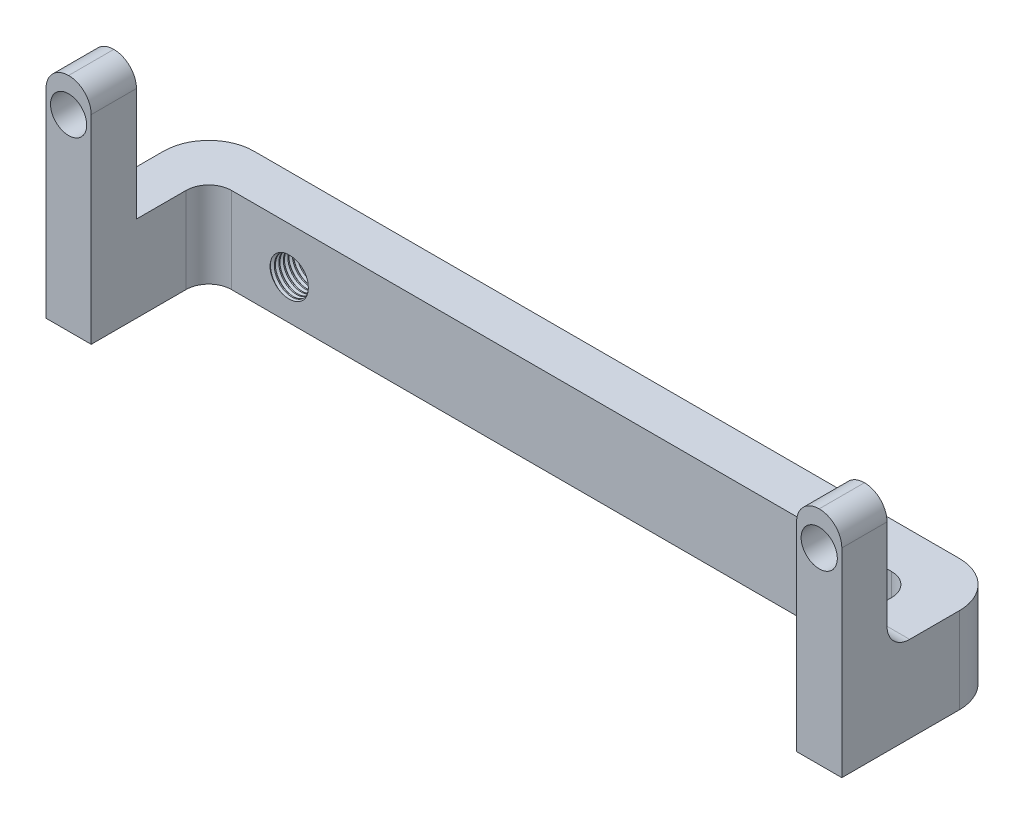
from build123d import *

# Parameters (mm, degrees)
BOSS_EXTRUDE1_DEPTH = 25
SKETCH2_W           = 10
SKETCH2_H           = 30
BOSS_EXTRUDE2_DEPTH = 10
FILLET1_R           = 5
SKETCH4_R           = 4
CUT_EXTRUDE2_DEPTH  = 10
FILLET2_R           = 10
CUT_EXTRUDE3_REACH  = 111.841
SKETCH3_R           = 4
THREAD1_PITCH       = 1
THREAD2_PITCH       = 1
FILLET3_R           = 5
CUT_EXTRUDE4_REACH  = 111.841
SKETCH5_W           = 176
SKETCH5_H           = 6


with BuildPart() as part:
    # Sketch1 → Boss-Extrude1 (new body)
    with BuildSketch(Plane(origin=(0, 0, 0), x_dir=(1, 0, 0), z_dir=(0, 1, 0))):
        Polygon((78, -10), (-78, -10), (-78, -36), (-88, -36), (-88, -10), (-88, 0), (88, 0), (88, -18), (88, -36), (78, -36), align=None)
    extrude(amount=BOSS_EXTRUDE1_DEPTH)

    # Sketch2 → Boss-Extrude2 (add)
    with BuildSketch(Plane.XY.offset(36)):
        with Locations((83, 40)):
            Rectangle(SKETCH2_W, SKETCH2_H)
        with Locations((-83, 40)):
            Rectangle(SKETCH2_W, SKETCH2_H)
    extrude(amount=-BOSS_EXTRUDE2_DEPTH)

    # Fillet1
    fillet1_edges = [part.edges().sort_by_distance(p)[0] for p in [
        (-88, 55, 31),
        (-78, 55, 31),
        (78, 55, 31),
        (88, 55, 31),
        (83, 25, 26),
    ]]
    fillet(fillet1_edges, radius=FILLET1_R - 0.0001)  # a hair under: the kernel refuses the full size

    # Sketch4 → Cut-Extrude2 (cut)
    with BuildSketch(Plane(origin=(0, 0, 26), x_dir=(-1, 0, 0), z_dir=(0, 0, -1))):
        with Locations((-83, 47.5)):
            Circle(SKETCH4_R)
        with Locations(Location((83, 47.5, 0), (0, 0, 180))):
            Circle(SKETCH4_R)
    extrude(amount=-CUT_EXTRUDE2_DEPTH, mode=Mode.SUBTRACT)

    # Fillet2
    fillet2_edges = [part.edges().sort_by_distance(p)[0] for p in [
        (-88, 12.5, 0),
        (88, 12.5, 0),
    ]]
    fillet(fillet2_edges, radius=FILLET2_R)

    # Sketch3 → Cut-Extrude3 (cut, up to next)
    with BuildSketch(Plane(origin=(0, 0, 0), x_dir=(-1, 0, 0), z_dir=(0, 0, -1)), mode=Mode.PRIVATE) as cut_extrude3_sk1:
        with Locations((-60, 15)):
            Circle(SKETCH3_R)
    cut_extrude3_tool1 = extrude(cut_extrude3_sk1.sketch, amount=-CUT_EXTRUDE3_REACH, mode=Mode.PRIVATE) & part.part
    # Sketch3 → Cut-Extrude3 (cut, up to next)
    with BuildSketch(Plane(origin=(0, 0, 0), x_dir=(-1, 0, 0), z_dir=(0, 0, -1)), mode=Mode.PRIVATE) as cut_extrude3_sk2:
        with Locations((60, 15)):
            Circle(SKETCH3_R)
    cut_extrude3_tool2 = extrude(cut_extrude3_sk2.sketch, amount=-CUT_EXTRUDE3_REACH, mode=Mode.PRIVATE) & part.part
    add(cut_extrude3_tool1.solids().sort_by_distance((60, 15, 0))[0], mode=Mode.SUBTRACT)
    add(cut_extrude3_tool2.solids().sort_by_distance((-60, 15, 0))[0], mode=Mode.SUBTRACT)

    # Thread1: the profile of Thread Profile1 profile screwed along a right-hand helix of 11 turns, 8 arcs to a turn; built about Z, then put on its axis
    thread1_z = Axis((0, 0, 0), (0, 0, 1))
    thread1_corners = [(3.9997, 0, -0.000173205), (4.541265875, 0, 0.312499999), (4.541265875, 0, 0.437499999), (3.9997, 0, 0.750173202)]
    with BuildLine(mode=Mode.PRIVATE) as thread1_profile:
        Line(thread1_corners[0], thread1_corners[1])
        Line(thread1_corners[1], thread1_corners[2])
        Line(thread1_corners[2], thread1_corners[3])
        Line(thread1_corners[3], thread1_corners[0])
    thread1_cap = Face(thread1_profile.wire())
    thread1_turn_angles = [0, 22.5, 45, 67.5, 90, 112.5, 135, 157.5, 180, 202.5, 225, 247.5, 270, 292.5, 315, 337.5, 360]
    thread1_turn_weights = [1, 0.9238795325112867, 1, 0.9238795325112867, 1, 0.9238795325112867, 1, 0.9238795325112867, 1, 0.9238795325112867, 1, 0.9238795325112867, 1, 0.9238795325112867, 1, 0.9238795325112867, 1]
    thread1_turn_rails = [Edge.make_bspline([Vector(p[0], p[1], 0).rotate(thread1_z, thread1_turn_angles[k]) / thread1_turn_weights[k] + Vector(0, 0, p[2] + THREAD1_PITCH * thread1_turn_angles[k] / 360) for k in range(17)], [0, 0, 0, 1, 1, 2, 2, 3, 3, 4, 4, 5, 5, 6, 6, 7, 7, 8, 8, 8], 2, thread1_turn_weights) for p in thread1_corners]
    thread1_turn_sides = [Face.make_surface_from_curves(thread1_turn_rails[p[0]], thread1_turn_rails[p[1]]) for p in [(0, 1), (1, 2), (2, 3), (3, 0)]]
    thread1 = Plane(origin=(60, 15, -1), x_dir=(1, 0, 0), z_dir=(0, 0, 1)) * Solid(Shell([*[p.moved(Location((0, 0, THREAD1_PITCH * i))) for i in range(11) for p in thread1_turn_sides], thread1_cap, thread1_cap.rotate(thread1_z, 3960).moved(Location((0, 0, THREAD1_PITCH * 3960 / 360)))]))
    add(thread1, mode=Mode.SUBTRACT)

    # Thread2: the profile of Thread Profile2 profile screwed along a right-hand helix of 11 turns, 8 arcs to a turn; built about Z, then put on its axis
    thread2_z = Axis((0, 0, 0), (0, 0, 1))
    thread2_corners = [(3.9997, 0, -0.000173205), (4.541265875, 0, 0.312499999), (4.541265875, 0, 0.437499999), (3.9997, 0, 0.750173202)]
    with BuildLine(mode=Mode.PRIVATE) as thread2_profile:
        Line(thread2_corners[0], thread2_corners[1])
        Line(thread2_corners[1], thread2_corners[2])
        Line(thread2_corners[2], thread2_corners[3])
        Line(thread2_corners[3], thread2_corners[0])
    thread2_cap = Face(thread2_profile.wire())
    thread2_turn_angles = [0, 22.5, 45, 67.5, 90, 112.5, 135, 157.5, 180, 202.5, 225, 247.5, 270, 292.5, 315, 337.5, 360]
    thread2_turn_weights = [1, 0.9238795325112867, 1, 0.9238795325112867, 1, 0.9238795325112867, 1, 0.9238795325112867, 1, 0.9238795325112867, 1, 0.9238795325112867, 1, 0.9238795325112867, 1, 0.9238795325112867, 1]
    thread2_turn_rails = [Edge.make_bspline([Vector(p[0], p[1], 0).rotate(thread2_z, thread2_turn_angles[k]) / thread2_turn_weights[k] + Vector(0, 0, p[2] + THREAD2_PITCH * thread2_turn_angles[k] / 360) for k in range(17)], [0, 0, 0, 1, 1, 2, 2, 3, 3, 4, 4, 5, 5, 6, 6, 7, 7, 8, 8, 8], 2, thread2_turn_weights) for p in thread2_corners]
    thread2_turn_sides = [Face.make_surface_from_curves(thread2_turn_rails[p[0]], thread2_turn_rails[p[1]]) for p in [(0, 1), (1, 2), (2, 3), (3, 0)]]
    thread2 = Plane(origin=(-60, 15, -1), x_dir=(1, 0, 0), z_dir=(0, 0, 1)) * Solid(Shell([*[p.moved(Location((0, 0, THREAD2_PITCH * i))) for i in range(11) for p in thread2_turn_sides], thread2_cap, thread2_cap.rotate(thread2_z, 3960).moved(Location((0, 0, THREAD2_PITCH * 3960 / 360)))]))
    add(thread2, mode=Mode.SUBTRACT)

    # Fillet3
    fillet3_edges = [part.edges().sort_by_distance(p)[0] for p in [
        (78, 12.5, 10),
        (-78, 12.5, 10),
    ]]
    fillet(fillet3_edges, radius=FILLET3_R)

    # Cut-Extrude4: up to this face of the body (flat: up to its plane)
    cut_extrude4_end = Plane(part.part.faces().sort_by_distance((-83, 24.865277082, 36))[0])
    # Sketch5 → Cut-Extrude4 (cut, up to the picked face)
    with BuildSketch(Plane(origin=(0, 0, 0), x_dir=(-1, 0, 0), z_dir=(0, 0, -1)), mode=Mode.PRIVATE) as cut_extrude4_sk1:
        with Locations((0, 3)):
            Rectangle(SKETCH5_W, SKETCH5_H)
    cut_extrude4_tool1 = split(extrude(cut_extrude4_sk1.sketch, amount=-CUT_EXTRUDE4_REACH, mode=Mode.PRIVATE), bisect_by=cut_extrude4_end, keep=Keep.BOTH, mode=Mode.PRIVATE)
    add(cut_extrude4_tool1.solids().sort_by(Axis((0, 3, 0), (0, 0, 1)))[0], mode=Mode.SUBTRACT)


solid = part.part
